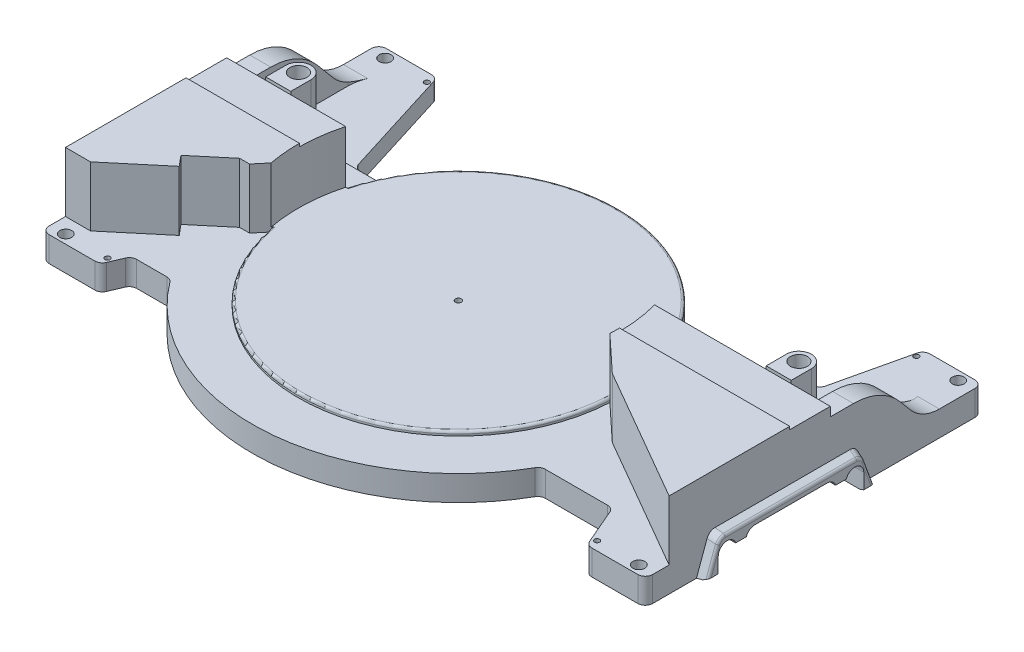
from build123d import *

# Parameters (mm, degrees)
BOSS_EXTRUDE1_DEPTH      = 20.6375
SKETCH55_R               = 12.7
CUT_EXTRUDE28_DEPTH      = 744.766543914
SKETCH4_R                = 9.0932
BOSS_EXTRUDE3_DEPTH      = 71.5137
BOSS_EXTRUDE9_DEPTH      = 7.8486
BOSS_EXTRUDE8_DEPTH      = 58.5978
CUT_EXTRUDE3_DEPTH       = 30.48
CUT_EXTRUDE4_START       = -7.8486
CUT_EXTRUDE4_DEPTH       = 7.8486
CUT_EXTRUDE6_START       = -27.432
CUT_EXTRUDE6_DEPTH       = 27.432
FILLET1_R                = 7.9375
BOSS_EXTRUDE5_DEPTH      = 9.144
BOSS_EXTRUDE5_TAPER      = 20
FILLET2_R                = 9.525
FILLET3_R                = 3.175
CUT_EXTRUDE2_DEPTH       = 38.1
FILLET2_OF_MIRROR3_R     = 9.525
FILLET3_OF_MIRROR3_R     = 3.175
SKETCH20_R               = 170.2562
BOSS_EXTRUDE12_DEPTH     = 33.02
SKETCH54_W               = 642.112
SKETCH54_H               = 43.18
CUT_EXTRUDE23_DEPTH      = 3.175
FILLET10_R               = 2.54
SKETCH56_R               = 6.35
SKETCH56_R_2             = 2.7813
CUT_EXTRUDE29_DEPTH      = 758.131687169
CUT_EXTRUDE30_DEPTH      = 758.131687169
CUT_EXTRUDE30_DEPTH_BACK = 758.131687169
SKETCH57_W               = 711.2
SKETCH57_H               = 25.4
SKETCH58_R               = 3.175
CUT_EXTRUDE31_DEPTH      = 757.923409535


with BuildPart() as part:
    # Sketch1 → Boss-Extrude1 (new body)
    with BuildSketch(Plane(origin=(0, 0, 0), x_dir=(1, 0, 0), z_dir=(0, 1, 0))):
        with BuildLine():
            Line((9.144, 0), (71.12, 0))
            Line((71.12, 0), (81.28, 23.749))
            Line((81.28, 23.749), (122.716390642, 23.749))
            ThreePointArc((122.716390642, 23.749), (314.2279161, -66.214930222), (492.502176554, 47.752))
            Line((492.502176554, 47.752), (568.706, 47.752))
            Line((568.706, 47.752), (589.28, 0))
            Line((589.28, 0), (651.256, 0))
            Line((651.256, 0), (651.256, 358.648))
            Line((651.256, 358.648), (589.28, 358.648))
            Line((589.28, 358.648), (568.706, 269.748))
            Line((568.706, 269.748), (486.156, 231.648))
            Line((486.156, 231.648), (450.725681801, 231.648))
            ThreePointArc((450.725681801, 231.648), (300.0375, 322.6562), (149.349318199, 231.648))
            Line((149.349318199, 231.648), (110.744, 231.648))
            Line((110.744, 231.648), (71.12, 358.648))
            Line((71.12, 358.648), (9.144, 358.648))
            Line((9.144, 358.648), (9.144, 0))
        make_face()
    extrude(amount=BOSS_EXTRUDE1_DEPTH)

    # Sketch55 → Cut-Extrude28 (cut, through all)
    with BuildSketch(Plane.XZ):
        with Locations(Location((300.0375, -152.4, 0), (0, 0, 270))):
            Circle(SKETCH55_R)
    extrude(amount=-CUT_EXTRUDE28_DEPTH, mode=Mode.SUBTRACT)

    # Sketch4 → Boss-Extrude3 (add)
    # profile 1 of 2: a face of its own
    with BuildSketch(Plane(origin=(0, 20.6375, 0), x_dir=(1, 0, 0), z_dir=(0, 1, 0))):
        with BuildLine():
            Line((9.144, 196.85), (9.144, 25.4))
            Line((9.144, 25.4), (35.7632, 25.4))
            Line((35.7632, 25.4), (87.076311476, 68.456812914))
            Line((87.076311476, 68.456812914), (77.821088214, 79.486758488))
            Line((77.821088214, 79.486758488), (111.793933595, 107.993360518))
            Line((111.793933595, 107.993360518), (122.339518561, 107.993360518))
            Line((122.339518561, 107.993360518), (132.808994851, 120.470396499))
            ThreePointArc((132.808994851, 120.470396499), (129.909304616, 158.82414582), (135.693135892, 196.85))
            Line((135.693135892, 196.85), (77.343, 196.85))
            Line((77.343, 196.85), (77.343, 218.313))
            ThreePointArc((77.343, 218.313), (64.008, 231.648), (50.673, 218.313))
            Line((50.673, 218.313), (50.673, 196.85))
            Line((50.673, 196.85), (9.144, 196.85))
        make_face()
        with Locations(Location((64.008, 218.313, 0), (0, 0, 90))):
            Circle(SKETCH4_R, mode=Mode.SUBTRACT)
    # profile 2 of 2: a face of its own
    with BuildSketch(Plane(origin=(0, 20.6375, 0), x_dir=(1, 0, 0), z_dir=(0, 1, 0))):
        with BuildLine():
            Line((651.256, 196.85), (609.727, 196.85))
            Line((609.727, 196.85), (609.727, 218.313))
            ThreePointArc((609.727, 218.313), (596.392, 231.648), (583.057, 218.313))
            Line((583.057, 218.313), (583.057, 196.85))
            Line((583.057, 196.85), (464.381864108, 196.85))
            ThreePointArc((464.381864108, 196.85), (469.32810441, 170.443385838), (470.058709393, 143.587459472))
            Line((470.058709393, 143.587459472), (508.275205835, 107.95))
            Line((508.275205835, 107.95), (651.256, 25.4))
            Line((651.256, 25.4), (651.256, 196.85))
        make_face()
        with Locations(Location((596.392, 218.313, 0), (0, 0, 270))):
            Circle(SKETCH4_R, mode=Mode.SUBTRACT)
    extrude(amount=BOSS_EXTRUDE3_DEPTH)

    # Sketch15 → Boss-Extrude9 (add)
    with BuildSketch(Plane(origin=(0, 20.6375, 0), x_dir=(1, 0, 0), z_dir=(0, 1, 0))):
        with BuildLine():
            Line((609.727, 196.85), (651.256, 196.85))
            Line((651.256, 196.85), (651.256, 358.648))
            Line((651.256, 358.648), (589.28, 358.648))
            Line((589.28, 358.648), (568.706, 269.748))
            Line((568.706, 269.748), (486.156, 231.648))
            Line((486.156, 231.648), (450.725681801, 231.648))
            ThreePointArc((450.725681801, 231.648), (300.0375, 322.6562), (149.349318199, 231.648))
            Line((149.349318199, 231.648), (110.744, 231.648))
            Line((110.744, 231.648), (71.12, 358.648))
            Line((71.12, 358.648), (9.144, 358.648))
            Line((9.144, 358.648), (9.144, 196.85))
            Line((9.144, 196.85), (50.673, 196.85))
            Line((50.673, 196.85), (50.673, 218.313))
            ThreePointArc((50.673, 218.313), (64.008, 231.648), (77.343, 218.313))
            Line((77.343, 218.313), (77.343, 196.85))
            Line((77.343, 196.85), (135.693135892, 196.85))
            ThreePointArc((135.693135892, 196.85), (129.909304616, 158.82414582), (132.808994851, 120.470396499))
            Line((132.808994851, 120.470396499), (122.339518561, 107.993360518))
            Line((122.339518561, 107.993360518), (111.793933595, 107.993360518))
            Line((111.793933595, 107.993360518), (77.821088214, 79.486758488))
            Line((77.821088214, 79.486758488), (87.076311476, 68.456812914))
            Line((87.076311476, 68.456812914), (35.7632, 25.4))
            Line((35.7632, 25.4), (9.144, 25.4))
            Line((9.144, 25.4), (9.144, 0))
            Line((9.144, 0), (71.12, 0))
            Line((71.12, 0), (81.28, 23.749))
            Line((81.28, 23.749), (122.716390642, 23.749))
            ThreePointArc((122.716390642, 23.749), (314.2279161, -66.214930222), (492.502176554, 47.752))
            Line((492.502176554, 47.752), (568.706, 47.752))
            Line((568.706, 47.752), (589.28, 0))
            Line((589.28, 0), (651.256, 0))
            Line((651.256, 0), (651.256, 25.4))
            Line((651.256, 25.4), (508.275205835, 107.95))
            Line((508.275205835, 107.95), (470.058709393, 143.587459472))
            ThreePointArc((470.058709393, 143.587459472), (469.32810441, 170.443385838), (464.381864108, 196.85))
            Line((464.381864108, 196.85), (583.057, 196.85))
            Line((583.057, 196.85), (583.057, 218.313))
            ThreePointArc((583.057, 218.313), (596.392, 231.648), (609.727, 218.313))
            Line((609.727, 218.313), (609.727, 196.85))
        make_face()
    extrude(amount=BOSS_EXTRUDE9_DEPTH)

    # Sketch13 → Boss-Extrude8 (add)
    with BuildSketch(Plane(origin=(0, 20.6375, 0), x_dir=(1, 0, 0), z_dir=(0, 1, 0))):
        with BuildLine():
            Line((651.256, 324.612), (623.824, 324.612))
            ThreePointArc((623.824, 324.612), (627.709521985, 314.518505496), (629.031, 303.784))
            Line((629.031, 303.784), (629.031, 196.85))
            Line((629.031, 196.85), (651.256, 196.85))
            Line((651.256, 196.85), (651.256, 324.612))
        make_face()
        with BuildLine():
            Line((9.144, 196.85), (9.144, 324.612))
            Line((9.144, 324.612), (36.576, 324.612))
            ThreePointArc((36.576, 324.612), (32.690478015, 314.518505496), (31.369, 303.784))
            Line((31.369, 303.784), (31.369, 196.85))
            Line((31.369, 196.85), (9.144, 196.85))
        make_face()
    extrude(amount=BOSS_EXTRUDE8_DEPTH)

    # Sketch14 → Cut-Extrude3 (cut)
    with BuildSketch(Plane(origin=(651.256, 0, 0), x_dir=(0, 0, -1), z_dir=(1, 0, 0))):
        with BuildLine():
            Line((358.648, 28.4861), (312.874753559, 28.4861))
            ThreePointArc((312.874753559, 28.4861), (296.038166351, 32.218681521), (282.356493371, 42.716998439))
            Line((282.356493371, 42.716998439), (271.167005189, 56.05211118))
            ThreePointArc((271.167005189, 56.05211118), (248.878545369, 73.15464792), (221.450496324, 79.2353))
            Line((221.450496324, 79.2353), (196.85, 79.2353))
            Line((196.85, 79.2353), (196.85, 92.1512))
            Line((196.85, 92.1512), (358.648, 92.1512))
            Line((358.648, 92.1512), (358.648, 28.4861))
        make_face()
    extrude(amount=-CUT_EXTRUDE3_DEPTH, mode=Mode.SUBTRACT)

    # Sketch16 → Cut-Extrude4 (cut)
    with BuildSketch(Plane(origin=(0, 28.4861, 0), x_dir=(1, 0, 0), z_dir=(0, 1, 0)).offset(CUT_EXTRUDE4_START)):
        with BuildLine():
            Line((31.369, 223.774), (51.842487105, 223.774))
            ThreePointArc((51.842487105, 223.774), (64.008, 231.648), (76.173512895, 223.774))
            Line((76.173512895, 223.774), (145.471576724, 223.774))
            ThreePointArc((145.471576724, 223.774), (147.363495159, 227.736052191), (149.356953777, 231.648))
            Line((149.356953777, 231.648), (110.744, 231.648))
            Line((110.744, 231.648), (71.12, 358.648))
            Line((71.12, 358.648), (9.144, 358.648))
            Line((9.144, 358.648), (9.144, 324.612))
            Line((9.144, 324.612), (36.576, 324.612))
            ThreePointArc((36.576, 324.612), (32.690478015, 314.518505496), (31.369, 303.784))
            Line((31.369, 303.784), (31.369, 223.774))
        make_face()
    extrude(amount=CUT_EXTRUDE4_DEPTH, mode=Mode.SUBTRACT)

    # Sketch17 → Cut-Extrude6 (cut)
    with BuildSketch(Plane.ZY.offset(-9.144).offset(CUT_EXTRUDE6_START)):
        with BuildLine():
            Line((-196.85, 92.1512), (-196.85, 79.2353))
            Line((-196.85, 79.2353), (-221.450496324, 79.2353))
            ThreePointArc((-221.450496324, 79.2353), (-248.878545369, 73.15464792), (-271.167005189, 56.05211118))
            Line((-271.167005189, 56.05211118), (-287.879736214, 36.134653938))
            ThreePointArc((-287.879736214, 36.134653938), (-302.778794991, 24.702204043), (-321.113490082, 20.6375))
            Line((-321.113490082, 20.6375), (-358.648, 20.6375))
            Line((-358.648, 20.6375), (-358.648, 92.1512))
            Line((-358.648, 92.1512), (-196.85, 92.1512))
        make_face()
    extrude(amount=CUT_EXTRUDE6_DEPTH, mode=Mode.SUBTRACT)

    # Fillet1
    fillet1_edges = [part.edges().sort_by_distance(p)[0] for p in [
        (71.12, 14.24305, 0),
        (9.144, 14.24305, 0),
        (450.725681801, 14.24305, -231.648),
        (486.156, 14.24305, -231.648),
        (568.706, 14.24305, -269.748),
        (589.28, 14.24305, -358.648),
        (651.256, 14.24305, -358.648),
        (651.256, 14.24305, 0),
        (589.28, 14.24305, 0),
        (568.706, 14.24305, -47.752),
        (492.502176554, 14.24305, -47.752),
        (122.716390642, 14.24305, -23.749),
        (81.28, 14.24305, -23.749),
        (9.144, 10.31875, -358.648),
        (71.12, 10.31875, -358.648),
        (110.744, 10.31875, -231.648),
        (149.349318199, 10.31875, -231.648),
    ]]
    fillet(fillet1_edges, radius=FILLET1_R)

    # Sketch8 → Boss-Extrude5 (add)
    with BuildSketch(Plane.ZY.offset(-9.144)):
        Polygon((-237.998, 0), (-53.848, 0), (-67.900162805, 38.608), (-223.945837195, 38.608), align=None)
    boss_extrude5 = extrude(amount=BOSS_EXTRUDE5_DEPTH, taper=BOSS_EXTRUDE5_TAPER)

    # Fillet2
    fillet2_edges = [part.edges().sort_by_distance(p)[0] for p in [
        (4.572, 36.943928089, -69.065358501),
        (4.572, 36.943928089, -222.780641499),
    ]]
    fillet(fillet2_edges, radius=FILLET2_R)

    # Fillet3
    fillet3_edges = [part.edges().sort_by_distance(p)[0] for p in [
        (0, 16.359351889, -63.344053819),
        (0, 35.279856178, -145.923),
        (0, 16.359351889, -228.501946181),
        (0, 33.681514913, -220.496275199),
        (0, 33.681514912, -71.349724799),
    ]]
    fillet(fillet3_edges, radius=FILLET3_R)

    # Sketch6 → Cut-Extrude2 (cut)
    with BuildSketch(Plane.ZY):
        with BuildLine():
            Line((-223.347675769, 19.558), (-223.347675769, 0))
            Line((-223.347675769, 0), (-68.498324231, 0))
            Line((-68.498324231, 0), (-68.498324231, 19.558))
            ThreePointArc((-68.498324231, 19.558), (-76.505049384, 28.961215753), (-87.064301447, 22.555725136))
            Line((-87.064301447, 22.555725136), (-98.494301447, 22.555725136))
            ThreePointArc((-98.494301447, 22.555725136), (-101.959783479, 27.280660064), (-107.535278662, 29.083))
            Line((-107.535278662, 29.083), (-184.310721338, 29.083))
            ThreePointArc((-184.310721338, 29.083), (-189.886216521, 27.280660064), (-193.351698553, 22.555725136))
            Line((-193.351698553, 22.555725136), (-204.781698553, 22.555725136))
            ThreePointArc((-204.781698553, 22.555725136), (-215.340950616, 28.961215753), (-223.347675769, 19.558))
        make_face()
    cut_extrude2 = extrude(amount=-CUT_EXTRUDE2_DEPTH, mode=Mode.SUBTRACT)

    # Mirror3: Boss-Extrude5, Cut-Extrude2 across plane
    add(boss_extrude5.mirror(Plane(origin=(330.2, 0, 0), x_dir=(0, 0, 1), z_dir=(1, 0, 0))))
    add(cut_extrude2.mirror(Plane(origin=(330.2, 0, 0), x_dir=(0, 0, 1), z_dir=(1, 0, 0))), mode=Mode.SUBTRACT)

    # Fillet2 of Mirror3
    fillet2_of_mirror3_edges = [part.edges().sort_by_distance(p)[0] for p in [
        (655.828, 36.943928089, -69.065358501),
        (655.828, 36.943928089, -222.780641499),
    ]]
    fillet(fillet2_of_mirror3_edges, radius=FILLET2_OF_MIRROR3_R)

    # Fillet3 of Mirror3
    fillet3_of_mirror3_edges = [part.edges().sort_by_distance(p)[0] for p in [
        (660.4, 16.359351889, -63.344053819),
        (660.4, 35.279856178, -145.923),
        (660.4, 16.359351889, -228.501946181),
        (660.4, 33.681514913, -220.496275199),
        (660.4, 33.681514912, -71.349724799),
    ]]
    fillet(fillet3_of_mirror3_edges, radius=FILLET3_OF_MIRROR3_R)

    # Sketch20 → Boss-Extrude12 (add)
    with BuildSketch(Plane.XZ):
        with Locations((300.0375, -152.4)):
            Circle(SKETCH20_R)
    extrude(amount=-BOSS_EXTRUDE12_DEPTH)

    # Sketch54 → Cut-Extrude23 (cut)
    with BuildSketch(Plane(origin=(0, 92.1512, 0), x_dir=(1, 0, 0), z_dir=(0, 1, 0))):
        with Locations((330.2, 175.26)):
            Rectangle(SKETCH54_W, SKETCH54_H)
    extrude(amount=-CUT_EXTRUDE23_DEPTH, mode=Mode.SUBTRACT)

    # Fillet10
    # the kernel refuses this fillet: 2.54 mm, written as the material it takes off along each edge
    with BuildSketch(Plane(origin=(300.0375, 33.02, -152.4), x_dir=(0.9998952949131444, 0, 0.014470632693694125), z_dir=(0.014470632693694125, 0, -0.9998952949131444))) as fillet10_piece_1_section:
        with BuildLine():
            CenterArc((170.2562 - FILLET10_R, FILLET10_R), FILLET10_R, 270, 90)
            Line((170.2562 - FILLET10_R, 0), (170.2562, 0))
            Line((170.2562, 0), (170.2562, FILLET10_R))
        make_face()
    fillet10_piece_1 = revolve(axis=Axis((300.0375, 33.02, -152.4), (0, -1, 0)), revolution_arc=170.499279523, mode=Mode.PRIVATE)
    fillet10_piece_1 = split(fillet10_piece_1, bisect_by=Plane(origin=(465.671268143, 30.572649711, -147.678814626), z_dir=(-0.6819983600625025, 0, 0.7313537016191668)), keep=Keep.TOP, mode=Mode.PRIVATE)
    fillet10_piece_1 = split(fillet10_piece_1, bisect_by=Plane(origin=(138.798801704, 30.572649711, -127.608770335), z_dir=(0.7660444431189772, 0, 0.6427876096865405)), keep=Keep.TOP, mode=Mode.PRIVATE)
    add(fillet10_piece_1, mode=Mode.SUBTRACT)
    with BuildSketch(Plane(origin=(300.0375, 33.02, -152.4), x_dir=(-0.9743910173799515, 0, -0.2248602793942567), z_dir=(-0.2248602793942567, 0, 0.9743910173799515))) as fillet10_piece_2_section:
        with BuildLine():
            CenterArc((170.2562 - FILLET10_R, FILLET10_R), FILLET10_R, 270, 90)
            Line((170.2562 - FILLET10_R, 0), (170.2562, 0))
            Line((170.2562, 0), (170.2562, FILLET10_R))
        make_face()
    fillet10_piece_2 = revolve(axis=Axis((300.0375, 33.02, -152.4), (0, -1, 0)), revolution_arc=154.010675545, mode=Mode.PRIVATE)
    fillet10_piece_2 = split(fillet10_piece_2, bisect_by=Plane(origin=(300.0375, 30.57264946, -196.85), z_dir=(0, 0, -1)), keep=Keep.TOP, mode=Mode.PRIVATE)
    add(fillet10_piece_2, mode=Mode.SUBTRACT)

    # Sketch56 → Cut-Extrude29 (cut, through all)
    with BuildSketch(Plane.XZ):
        with Locations(Location((25.4, -9.4488, 0), (0, 0, 270))):
            Circle(SKETCH56_R)
        with Locations(Location((25.4, -349.1738, 0), (0, 0, 270))):
            Circle(SKETCH56_R)
        with Locations(Location((635, -9.4488, 0), (0, 0, 270))):
            Circle(SKETCH56_R)
        with Locations(Location((635, -349.1738, 0), (0, 0, 270))):
            Circle(SKETCH56_R)
        with Locations(Location((69.85, -9.4488, 0), (0, 0, 270))):
            Circle(SKETCH56_R_2)
        with Locations(Location((69.85, -349.1738, 0), (0, 0, 270))):
            Circle(SKETCH56_R_2)
        with Locations(Location((590.55, -9.4488, 0), (0, 0, 270))):
            Circle(SKETCH56_R_2)
        with Locations(Location((590.55, -349.1738, 0), (0, 0, 270))):
            Circle(SKETCH56_R_2)
    extrude(amount=-CUT_EXTRUDE29_DEPTH, mode=Mode.SUBTRACT)

    # Sketch57 → Cut-Extrude30 (cut, two sides: drawn at the far end of the back side and taken through both)
    with BuildSketch(Plane.XY.offset(-CUT_EXTRUDE30_DEPTH_BACK)):
        with Locations((330.2, -10.9728)):
            Rectangle(SKETCH57_W, SKETCH57_H)
    extrude(amount=CUT_EXTRUDE30_DEPTH + CUT_EXTRUDE30_DEPTH_BACK, mode=Mode.SUBTRACT)

    # Sketch58 → Cut-Extrude31 (cut, through all)
    with BuildSketch(Plane.XZ.offset(-1.7272)):
        with Locations(Location((300.0375, -152.4, 0), (0, 0, 270))):
            Circle(SKETCH58_R)
    extrude(amount=-CUT_EXTRUDE31_DEPTH, mode=Mode.SUBTRACT)


solid = part.part
